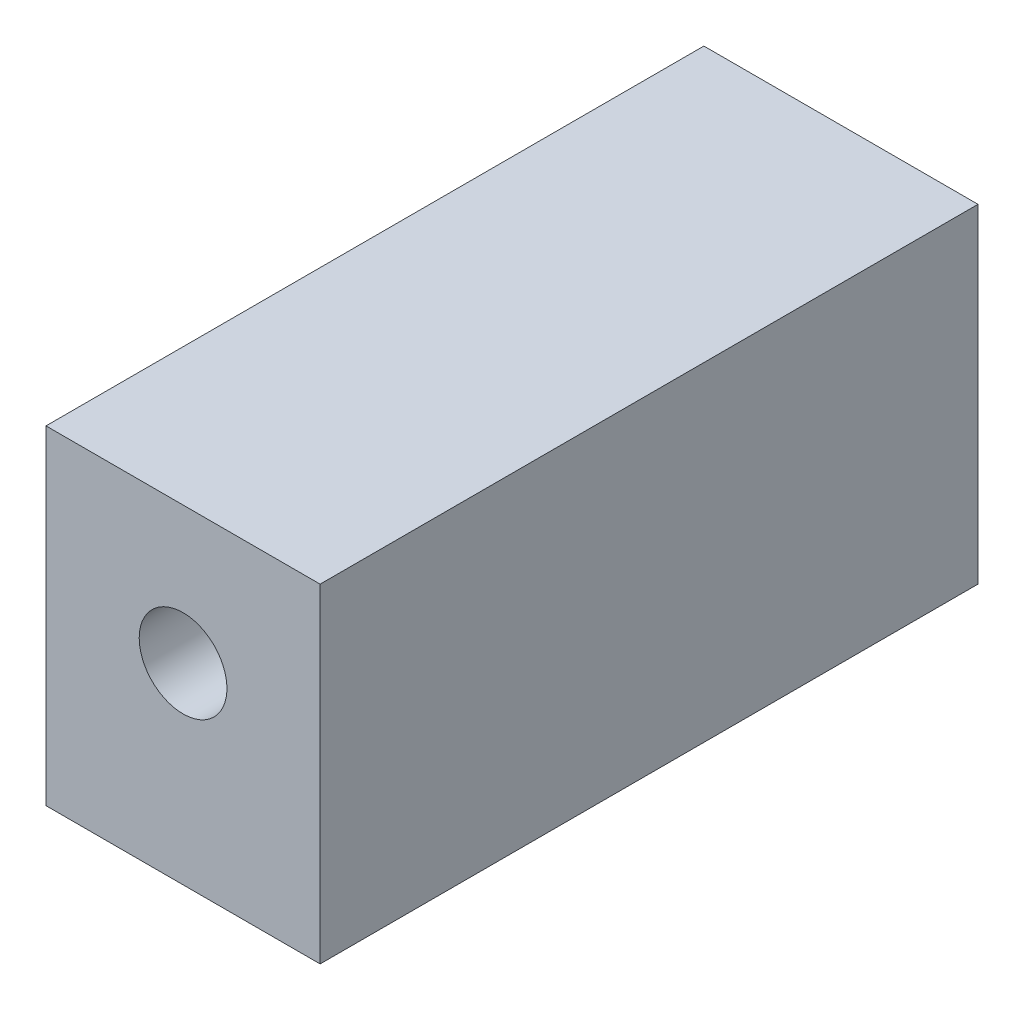
from build123d import *

# Parameters (mm, degrees)
SKETCH_1_W          = 25
SKETCH_1_H          = 30
EXTRUDE_1_DEPTH     = 60
SKETCH_2_R          = 9.8
CUT_EXTRUDE_1_DEPTH = 50
SKETCH_3_R          = 4
CUT_EXTRUDE_2_DEPTH = 56.10562262


with BuildPart() as part:
    # ｽｹｯﾁ1 → ﾎﾞｽ - 押し出し1 (new body)
    with BuildSketch(Plane.XY):
        with Locations((1.917887822, -3.131578947)):
            Rectangle(SKETCH_1_W, SKETCH_1_H)
    extrude(amount=EXTRUDE_1_DEPTH)

    # ｽｹｯﾁ2 → ｶｯﾄ - 押し出し1 (cut)
    with BuildSketch(Plane(origin=(0, 0, 0), x_dir=(-1, 0, 0), z_dir=(0, 0, -1))):
        with Locations((-1.917887822, -0.631578947)):
            Circle(SKETCH_2_R)
    extrude(amount=-CUT_EXTRUDE_1_DEPTH, mode=Mode.SUBTRACT)

    # ｽｹｯﾁ3 → ｶｯﾄ - 押し出し2 (cut, through all)
    with BuildSketch(Plane(origin=(0, 0, 50), x_dir=(-1, 0, 0), z_dir=(0, 0, -1))):
        with Locations((-1.917887822, -0.631578947)):
            Circle(SKETCH_3_R)
    extrude(amount=-CUT_EXTRUDE_2_DEPTH, mode=Mode.SUBTRACT)


solid = part.part
